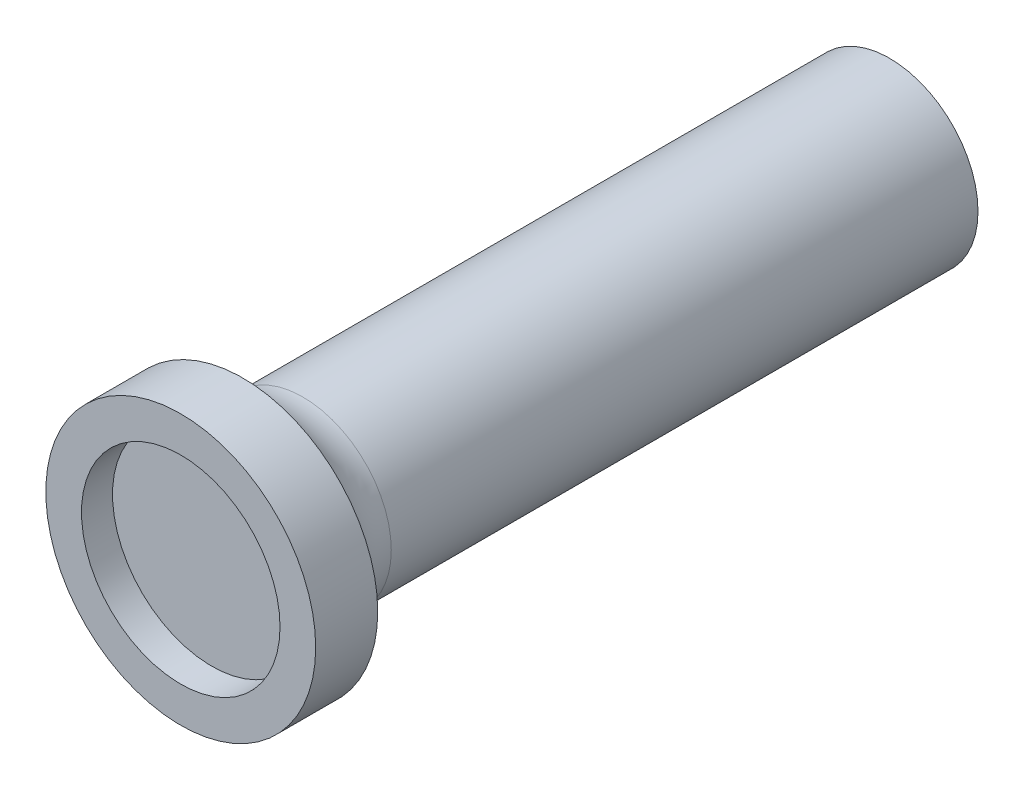
from build123d import *

# Parameters (mm, degrees)
ESQUISSE1_R             = 2.85
SHAPE_DEPTH             = 20.85
ESQUISSE2_R             = 4.35
BOSS_EXTRU_2_DEPTH      = 2
ESQUISSE3_R             = 3.2
ENL_V_MAT_EXTRU_1_DEPTH = 1
CONG_1_R                = 2
ESQUISSE4_R             = 0.8
ALIGNBEAM_DEPTH         = 0.8


with BuildPart() as part:
    # Esquisse1 → Shape (new body)
    with BuildSketch(Plane.XY):
        Circle(ESQUISSE1_R)
    extrude(amount=SHAPE_DEPTH)

    # Esquisse2 → Boss.-Extru.2 (add)
    with BuildSketch(Plane.XY.offset(20.85)):
        Circle(ESQUISSE2_R)
    extrude(amount=BOSS_EXTRU_2_DEPTH)

    # Esquisse3 → Enlèv. mat.-Extru.1 (cut)
    with BuildSketch(Plane.XY.offset(22.85)):
        Circle(ESQUISSE3_R)
    extrude(amount=-ENL_V_MAT_EXTRU_1_DEPTH, mode=Mode.SUBTRACT)

    # Congé1
    # the kernel refuses this fillet: 2 mm, written as the material it adds along each edge
    with BuildSketch(Plane(origin=(0, 0, 20.85), x_dir=(1, 0, 0), z_dir=(0, -1, 0))) as cong_1_piece_1:
        with BuildLine():
            CenterArc((4.85, -1.936491673), CONG_1_R, 104.477512186, 75.522487814)
            Line((2.85, -1.936491673), (2.81, -1.936491673))
            Line((2.81, -1.936491673), (2.81, 0))
            Line((2.81, 0), (2.85, 0.04))
            ThreePointArc((2.85, 0.04), (3.6, 0.04), (4.34, 0.038729833))
            Line((4.34, 0.038729833), (4.35, 0))
        make_face()
    revolve(axis=Axis((0, 0, 20.85), (0, 0, 1)))

    # Esquisse4 → AlignBeam (add)
    with BuildSketch(Plane(origin=(0, 0, 0), x_dir=(-1, 0, 0), z_dir=(0, 0, -1))):
        Circle(ESQUISSE4_R)
    extrude(amount=ALIGNBEAM_DEPTH)


solid = part.part
